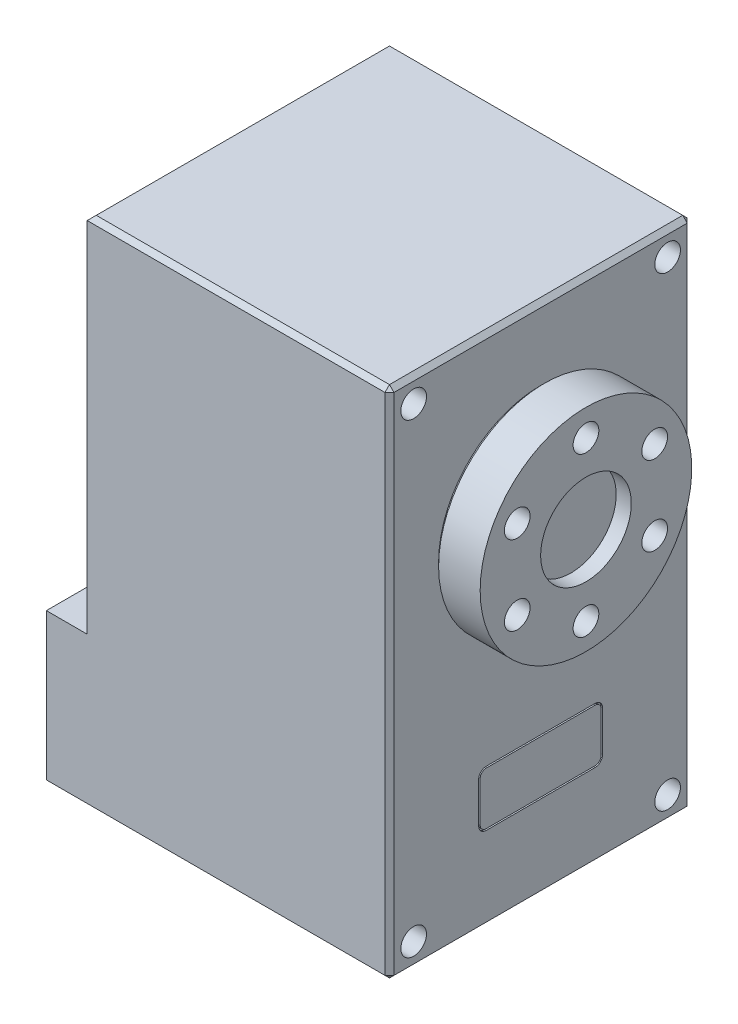
from build123d import *

# Parameters (mm, degrees)
SKETCH_1_W                 = 20
SKETCH_1_H                 = 20
EXTRUDE_1_DEPTH            = 34
SKETCH_2_R                 = 6.75
EXTRUDE_3_DEPTH            = 0.25
SKETCH_3_R                 = 7
EXTRUDE_4_DEPTH            = 2.75
CHAMFER_2_SIZE             = 0.25
SKETCH_4_R                 = 0.85
CUT_EXTRUDE_1_DEPTH        = 3
CHAMFER_2_OF_MIRROR_3_SIZE = 0.25
SKETCH_17_W                = 3
SKETCH_17_H                = 10
EXTRUDE_5_DEPTH            = 20
SKETCH_18_W                = 1.95
SKETCH_18_H                = 7
CUT_EXTRUDE_3_DEPTH        = 5
SKETCH_19_W                = 4.8
SKETCH_19_H                = 0.3
EXTRUDE_6_DEPTH            = 0.3
SKETCH_21_W                = 0.123776974
SKETCH_21_H                = 0.305182562
EXTRUDE_7_DEPTH            = 4.8
CHAMFER_3_SIZE             = 0.2
CHAMFER_3_OF_MIRROR_5_SIZE = 0.2
RIB_16_REACH               = 39.749
SKETCH_22_WALL_W           = 83.688269594
SKETCH_22_WALL_H           = 8
CUT_EXTRUDE_4_DEPTH        = 3
SKETCH_24_W                = 3.905478566
SKETCH_24_H                = 1.608534126
SKETCH_24_W_2              = 3.705478566
SKETCH_24_H_2              = 1.408534126
CUT_EXTRUDE_1_2_DEPTH      = 0.1
CUT_EXTRUDE_2_DEPTH        = 0.1
SKETCH_26_R                = 3
CUT_EXTRUDE_5_DEPTH        = 1
SKETCH_27_R                = 0.85
CUT_EXTRUDE_6_DEPTH        = 3
SKETCH_28_R                = 0.85
CUT_EXTRUDE_7_DEPTH        = 3
SKETCH_30_R                = 0.85
CUT_EXTRUDE_8_DEPTH        = 3
CHAMFER_4_SIZE             = 0.3


with BuildPart() as part:
    # 草图1 → 凸台-拉伸1 (new body)
    with BuildSketch(Plane(origin=(0, 0, 0), x_dir=(1, 0, 0), z_dir=(0, 1, 0))):
        Rectangle(SKETCH_1_W, SKETCH_1_H)
    extrude(amount=EXTRUDE_1_DEPTH)

    # 草图2 → 凸台-拉伸3 (add)
    with BuildSketch(Plane.ZY.offset(10)):
        with Locations((0, 22.5)):
            Circle(SKETCH_2_R)
    extrude_3 = extrude(amount=EXTRUDE_3_DEPTH)

    # 草图3 → 凸台-拉伸4 (add)
    with BuildSketch(Plane.ZY.offset(10.25)):
        with Locations((0, 22.5)):
            Circle(SKETCH_3_R)
    extrude_4 = extrude(amount=EXTRUDE_4_DEPTH)

    # 倒角2
    chamfer_2_edges = [part.edges().sort_by_distance(p)[0] for p in [
        (-10.25, 22.5, -6.75),
    ]]
    chamfer(chamfer_2_edges, length=CHAMFER_2_SIZE - 0.0001)  # a hair under: the kernel refuses the full size

    # 草图4 → Cut-Extrude 1 (cut)
    with BuildSketch(Plane.ZY.offset(13)):
        with Locations((0, 27.75)):
            Circle(SKETCH_4_R)
        with Locations((4.54663337, 25.125)):
            Circle(SKETCH_4_R)
        with Locations((4.54663337, 19.875)):
            Circle(SKETCH_4_R)
        with Locations((0, 17.25)):
            Circle(SKETCH_4_R)
        with Locations((-4.54663337, 19.875)):
            Circle(SKETCH_4_R)
        with Locations((-4.54663337, 25.125)):
            Circle(SKETCH_4_R)
    cut_extrude_1 = extrude(amount=-CUT_EXTRUDE_1_DEPTH, mode=Mode.SUBTRACT)

    # 镜向3: 凸台-拉伸3, 凸台-拉伸4, Cut-Extrude 1 across plane
    add(extrude_3.mirror(Plane(origin=(0, 0, 0), x_dir=(0, 0, 1), z_dir=(1, 0, 0))))
    add(extrude_4.mirror(Plane(origin=(0, 0, 0), x_dir=(0, 0, 1), z_dir=(1, 0, 0))))
    add(cut_extrude_1.mirror(Plane(origin=(0, 0, 0), x_dir=(0, 0, 1), z_dir=(1, 0, 0))), mode=Mode.SUBTRACT)

    # 倒角2 of 镜向3
    chamfer_2_of_mirror_3_edges = [part.edges().sort_by_distance(p)[0] for p in [
        (10.25, 22.5, -6.75),
    ]]
    chamfer(chamfer_2_of_mirror_3_edges, length=CHAMFER_2_OF_MIRROR_3_SIZE - 0.0001)  # a hair under: the kernel refuses the full size

    # 草图17 → 凸台-拉伸5 (add)
    with BuildSketch(Plane.XY.offset(10)):
        with Locations((-11.5, 5)):
            Rectangle(SKETCH_17_W, SKETCH_17_H)
    extrude(amount=-EXTRUDE_5_DEPTH)

    # 草图18 → 切除-拉伸3 (cut)
    with BuildSketch(Plane.ZY.offset(10)):
        Polygon((7.5, 10), (5, 10), (5, 12.35), (4.257856932, 12.35), (4.257856932, 14.65), (5, 14.65), (5, 17), (7.5, 17), align=None)
        with Locations((8.775, 13.5)):
            Rectangle(SKETCH_18_W, SKETCH_18_H)
    cut_extrude_3 = extrude(amount=-CUT_EXTRUDE_3_DEPTH, mode=Mode.SUBTRACT)

    # 草图19 → 凸台-拉伸6 (add)
    with BuildSketch(Plane(origin=(0, 0, 7.5), x_dir=(-1, 0, 0), z_dir=(0, 0, -1))):
        with Locations((7.4, 15.1)):
            Rectangle(SKETCH_19_W, SKETCH_19_H)
        with Locations((7.4, 13.5)):
            Rectangle(SKETCH_19_W, SKETCH_19_H)
        with Locations((7.4, 11.9)):
            Rectangle(SKETCH_19_W, SKETCH_19_H)
    extrude_6 = extrude(amount=EXTRUDE_6_DEPTH)

    # 草图21 → 凸台-拉伸7 (add)
    with BuildSketch(Plane.ZY.offset(5)):
        with Locations((9.688111513, 14.402859295)):
            Rectangle(SKETCH_21_W, SKETCH_21_H)
        with Locations((9.688111513, 12.597140705)):
            Rectangle(SKETCH_21_W, SKETCH_21_H)
    extrude_7 = extrude(amount=EXTRUDE_7_DEPTH)

    # 倒角3
    chamfer_3_edges = [part.edges().sort_by_distance(p)[0] for p in [
        (-7.5, 12.35, 5),
        (-7.5, 14.65, 5),
        (-10, 13.5, 7.5),
        (-10, 17, 6.25),
        (-10, 15.825, 5),
        (-10, 14.65, 4.628928466),
        (-10, 13.5, 4.257856932),
        (-10, 12.35, 4.628928466),
        (-10, 11.175, 5),
        (-10, 17, 8.775),
        (-10, 13.5, 9.75),
    ]]
    chamfer(chamfer_3_edges, length=CHAMFER_3_SIZE - 0.0001)  # a hair under: the kernel refuses the full size

    # 镜向5: 切除-拉伸3, 凸台-拉伸6, 凸台-拉伸7 across plane
    add(cut_extrude_3.mirror(Plane.XY), mode=Mode.SUBTRACT)
    add(extrude_6.mirror(Plane.XY))
    add(extrude_7.mirror(Plane.XY))

    # 倒角3 of 镜向5
    chamfer_3_of_mirror_5_edges = [part.edges().sort_by_distance(p)[0] for p in [
        (-7.5, 12.35, -5),
        (-7.5, 14.65, -5),
        (-10, 13.5, -7.5),
        (-10, 17, -6.25),
        (-10, 15.825, -5),
        (-10, 14.65, -4.628928466),
        (-10, 13.5, -4.257856932),
        (-10, 12.35, -4.628928466),
        (-10, 11.175, -5),
        (-10, 17, -8.775),
        (-10, 13.5, -9.75),
    ]]
    chamfer(chamfer_3_of_mirror_5_edges, length=CHAMFER_3_OF_MIRROR_5_SIZE - 0.0001)  # a hair under: the kernel refuses the full size

    # 草图22 wall → 筋16 (add, up to next)
    with BuildSketch(Plane(origin=(-11.5, 12.707174472, 0), x_dir=(0.484658519007, 0.874703446863, 0), z_dir=(-0.874703446863, 0.484658519007, 0)), mode=Mode.PRIVATE) as rib_16_sk1:
        Rectangle(SKETCH_22_WALL_W, SKETCH_22_WALL_H)
    rib_16_tool1 = extrude(rib_16_sk1.sketch, amount=-RIB_16_REACH, mode=Mode.PRIVATE) - part.part
    add(rib_16_tool1.solids().sort_by_distance((-11.5, 12.707174472, 0))[0])

    # 草图23 → 切除-拉伸4 (cut)
    with BuildSketch(Plane.ZY.offset(13)):
        with BuildLine():
            Line((-4, 15.414348944), (4, 15.414348944))
            ThreePointArc((4, 15.414348944), (0, 13.758308891), (-4, 15.414348944))
        make_face()
    extrude(amount=-CUT_EXTRUDE_4_DEPTH, mode=Mode.SUBTRACT)

    # 草图24 → Cut-Extrude 1 2 (cut)
    with BuildSketch(Plane(origin=(-14.185704331, 7.860061003, 0), x_dir=(0, 0, 1), z_dir=(-0.8747034468598147, 0.4846585190126751, 0))):
        with Locations((0, 5.774895226)):
            Rectangle(SKETCH_24_W, SKETCH_24_H)
        with Locations((0, 5.774895226)):
            Rectangle(SKETCH_24_W_2, SKETCH_24_H_2, mode=Mode.SUBTRACT)
    extrude(amount=-CUT_EXTRUDE_1_2_DEPTH, mode=Mode.SUBTRACT)

    # 草图25 → 切除-拉伸-薄壁2 (cut)
    with BuildSketch(Plane(origin=(10, 0, 0), x_dir=(0, 0, -1), z_dir=(1, 0, 0))):
        with BuildLine():
            Line((-4.099561759, 8.730027327), (-4.099561759, 6.057481545))
            ThreePointArc((-4.099561759, 6.057481545), (-3.953115149, 5.703928154), (-3.599561759, 5.557481545))
            Line((-3.599561759, 5.557481545), (3.599561759, 5.557481545))
            ThreePointArc((3.599561759, 5.557481545), (3.953115149, 5.703928154), (4.099561759, 6.057481545))
            Line((4.099561759, 6.057481545), (4.099561759, 8.730027327))
            ThreePointArc((4.099561759, 8.730027327), (3.953115149, 9.083580717), (3.599561759, 9.230027327))
            Line((3.599561759, 9.230027327), (-3.599561759, 9.230027327))
            ThreePointArc((-3.599561759, 9.230027327), (-3.953115149, 9.083580717), (-4.099561759, 8.730027327))
        make_face()
        with BuildLine():
            Line((-3.999561759, 8.730027327), (-3.999561759, 6.057481545))
            ThreePointArc((-3.999561759, 6.057481545), (-3.882404471, 5.774638832), (-3.599561759, 5.657481545))
            Line((-3.599561759, 5.657481545), (3.599561759, 5.657481545))
            ThreePointArc((3.599561759, 5.657481545), (3.882404471, 5.774638832), (3.999561759, 6.057481545))
            Line((3.999561759, 6.057481545), (3.999561759, 8.730027327))
            ThreePointArc((3.999561759, 8.730027327), (3.882404471, 9.012870039), (3.599561759, 9.130027327))
            Line((3.599561759, 9.130027327), (-3.599561759, 9.130027327))
            ThreePointArc((-3.599561759, 9.130027327), (-3.882404471, 9.012870039), (-3.999561759, 8.730027327))
        make_face(mode=Mode.SUBTRACT)
    extrude(amount=-CUT_EXTRUDE_2_DEPTH, mode=Mode.SUBTRACT)

    # 草图26 → 切除-拉伸5 (cut)
    with BuildSketch(Plane.ZY.offset(13)):
        with Locations((0, 22.5)):
            Circle(SKETCH_26_R)
    cut_extrude_5 = extrude(amount=-CUT_EXTRUDE_5_DEPTH, mode=Mode.SUBTRACT)

    # 镜向6: 切除-拉伸5 across plane
    add(cut_extrude_5.mirror(Plane(origin=(0, 0, 0), x_dir=(0, 0, 1), z_dir=(1, 0, 0))), mode=Mode.SUBTRACT)

    # 草图27 → 切除-拉伸6 (cut)
    with BuildSketch(Plane.ZY.offset(13)):
        with Locations((8.519383892, 1.385172654)):
            Circle(SKETCH_27_R)
        with Locations(Location((-8.519383892, 1.385172654, 0), (0, 0, 180))):
            Circle(SKETCH_27_R)
    extrude(amount=-CUT_EXTRUDE_6_DEPTH, mode=Mode.SUBTRACT)

    # 草图28 → 切除-拉伸7 (cut)
    with BuildSketch(Plane.ZY.offset(10)):
        with Locations((8.519383892, 32.582473708)):
            Circle(SKETCH_28_R)
        with Locations(Location((-8.519383892, 32.582473708, 0), (0, 0, 180))):
            Circle(SKETCH_28_R)
    extrude(amount=-CUT_EXTRUDE_7_DEPTH, mode=Mode.SUBTRACT)

    # 草图30 → 切除-拉伸8 (cut)
    with BuildSketch(Plane(origin=(10, 0, 0), x_dir=(0, 0, -1), z_dir=(1, 0, 0))):
        with Locations((-8.4, 32.4)):
            Circle(SKETCH_30_R)
        with Locations((8.4, 32.4)):
            Circle(SKETCH_30_R)
        with Locations((8.4, 1.6)):
            Circle(SKETCH_30_R)
        with Locations((-8.4, 1.6)):
            Circle(SKETCH_30_R)
    extrude(amount=-CUT_EXTRUDE_8_DEPTH, mode=Mode.SUBTRACT)

    # 倒角4
    chamfer_4_edges = [part.edges().sort_by_distance(p)[0] for p in [
        (-10, 34, 0),
        (0, 34, 10),
        (-13, 10, 7),
        (10, 34, 0),
        (-1.5, 0, 10),
        (-1.5, 0, -10),
        (10, 0, 0),
        (10, 17, 10),
        (10, 17, -10),
        (-13, 5, -10),
        (-13, 0, 0),
        (-13, 10, -7),
        (-13, 5, 10),
        (0, 34, -10),
    ]]
    chamfer(chamfer_4_edges, length=CHAMFER_4_SIZE)


solid = part.part
